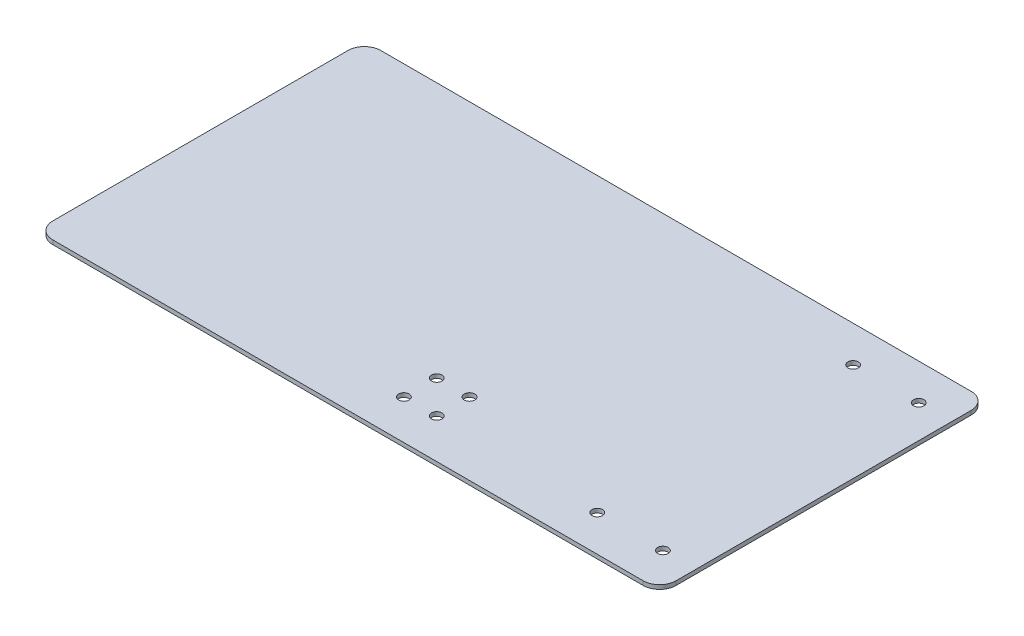
from build123d import *

# Parameters (mm, degrees)
SKETCH1_W           = 241.3
SKETCH1_H           = 127
SKETCH1_R           = 2.032
BOSS_EXTRUDE1_DEPTH = 1.5875
FILLET1_R           = 6.35


with BuildPart() as part:
    # Sketch1 → Boss-Extrude1 (new body)
    with BuildSketch(Plane(origin=(0, 0, 0), x_dir=(1, 0, 0), z_dir=(0, 1, 0))):
        Rectangle(SKETCH1_W, SKETCH1_H)
        with Locations((6.35, -48.1965)):
            Circle(SKETCH1_R, mode=Mode.SUBTRACT)
        with Locations((19.05, -48.1965)):
            Circle(SKETCH1_R, mode=Mode.SUBTRACT)
        with Locations((6.35, -35.4965)):
            Circle(SKETCH1_R, mode=Mode.SUBTRACT)
        with Locations((19.05, -35.4965)):
            Circle(SKETCH1_R, mode=Mode.SUBTRACT)
        with Locations((82.55, -49.53)):
            Circle(SKETCH1_R, mode=Mode.SUBTRACT)
        with Locations((107.95, -49.53)):
            Circle(SKETCH1_R, mode=Mode.SUBTRACT)
        with Locations((82.55, 49.53)):
            Circle(SKETCH1_R, mode=Mode.SUBTRACT)
        with Locations((107.95, 49.53)):
            Circle(SKETCH1_R, mode=Mode.SUBTRACT)
    extrude(amount=BOSS_EXTRUDE1_DEPTH)

    # Fillet1
    fillet1_edges = [part.edges().sort_by_distance(p)[0] for p in [
        (-120.65, 0.79375, -63.5),
        (-120.65, 0.79375, 63.5),
        (120.65, 0.79375, -63.5),
        (120.65, 0.79375, 63.5),
    ]]
    fillet(fillet1_edges, radius=FILLET1_R)


solid = part.part
